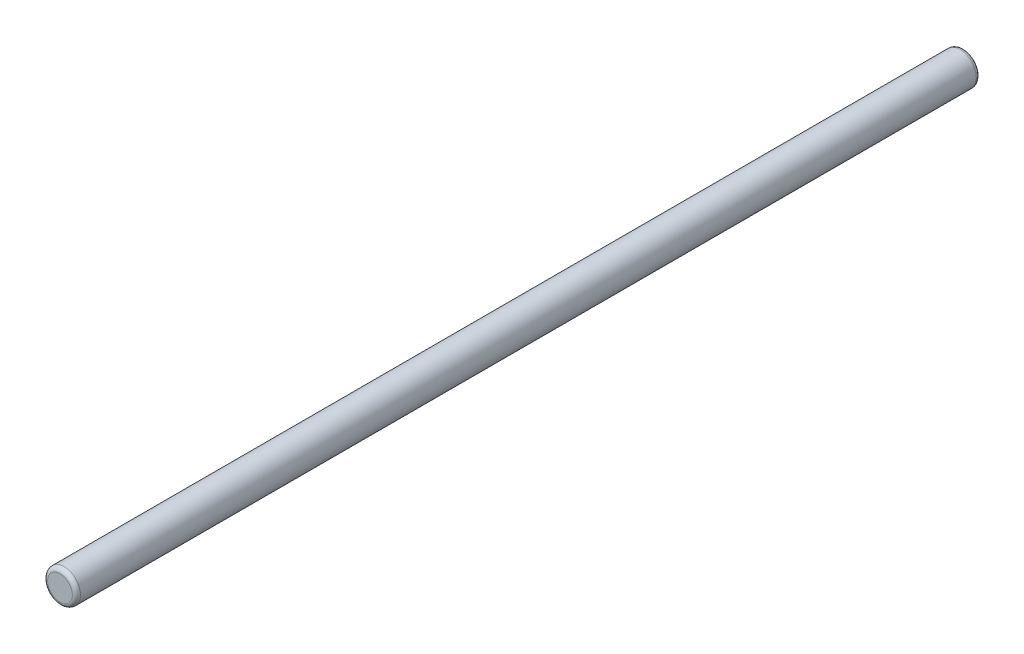
from build123d import *

# Parameters (mm, degrees)
SKIZZE1_R                       = 4
AUFSATZ_LINEAR_AUSTRAGEN1_DEPTH = 220
VERRUNDUNG1_R                   = 1


with BuildPart() as part:
    # Skizze1 → Aufsatz-Linear austragen1 (new body)
    with BuildSketch(Plane.XY):
        Circle(SKIZZE1_R)
    extrude(amount=AUFSATZ_LINEAR_AUSTRAGEN1_DEPTH)

    # Verrundung1
    verrundung1_edges = [part.edges().sort_by_distance(p)[0] for p in [
        (-4, 0, 220),
        (-4, 0, 0),
    ]]
    fillet(verrundung1_edges, radius=VERRUNDUNG1_R)


solid = part.part
